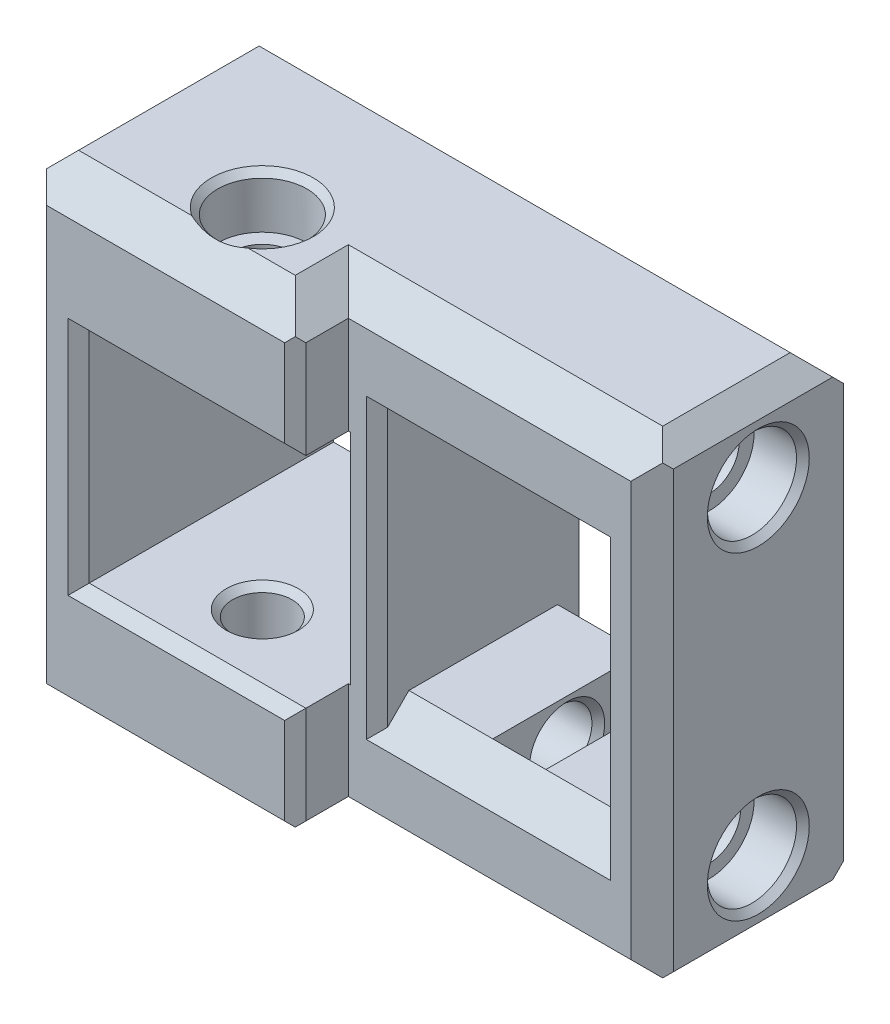
from build123d import *

# Parameters (mm, degrees)
SKETCH1_W               = 68.58
SKETCH1_H               = 57.15
BOSS_EXTRUDE1_DEPTH     = 31.75
SKETCH2_W               = 26.162
SKETCH2_H               = 26.162
SKETCH2_W_2             = 26.67
SKETCH2_H_2             = 27.94
CUT_EXTRUDE1_DEPTH      = 95.749149864
SKETCH5_R               = 3.556
SKETCH5_R_2             = 3.729278609
CUT_EXTRUDE2_DEPTH      = 95.749149864
CUT_EXTRUDE3_START      = -16.51
CUT_EXTRUDE3_DEPTH      = 6.35
SKETCH7_R               = 5.334
CUT_EXTRUDE4_DEPTH      = 5.842
CUT_EXTRUDE5_DEPTH      = 7.62
SKETCH10_W              = 36.322
SKETCH10_H              = 6.35
CUT_EXTRUDE6_DEPTH      = 95.749149864
CUT_EXTRUDE7_DEPTH      = 87.293112332
CUT_EXTRUDE7_DEPTH_BACK = 87.293112332
SKETCH12_R              = 3.556
SKETCH13_R              = 5.334
CUT_EXTRUDE8_DEPTH      = 6.35
CUT_EXTRUDE9_DEPTH      = 7.62
CHAMFER1_SIZE           = 0.762
CHAMFER3_SIZE           = 3.81
CHAMFER5_SIZE           = 1.27
CHAMFER6_SIZE           = 2.54
CHAMFER9_SIZE           = 3.81
CHAMFER10_SIZE          = 6.35


# Some blends are built 0.0001 mm under size
with BuildPart() as part:
    # Sketch1 → Boss-Extrude1 (new body)
    with BuildSketch(Plane.XY):
        with Locations((34.29, 28.575)):
            Rectangle(SKETCH1_W, SKETCH1_H)
    extrude(amount=BOSS_EXTRUDE1_DEPTH)

    # Sketch2 → Cut-Extrude1 (cut, through all)
    with BuildSketch(Plane.XY.offset(31.75)):
        with Locations((19.431, 28.575)):
            Rectangle(SKETCH2_W, SKETCH2_H)
        with Locations((49.022, 28.575)):
            Rectangle(SKETCH2_W_2, SKETCH2_H_2)
    extrude(amount=-CUT_EXTRUDE1_DEPTH, mode=Mode.SUBTRACT)

    # Sketch5 → Cut-Extrude2 (cut, through all)
    with BuildSketch(Plane(origin=(68.58, 0, 0), x_dir=(0, 0, -1), z_dir=(1, 0, 0))):
        with Locations((-12.7, 47.625)):
            Circle(SKETCH5_R)
        with Locations((-12.7, 9.525)):
            Circle(SKETCH5_R_2)
    extrude(amount=-CUT_EXTRUDE2_DEPTH, mode=Mode.SUBTRACT)

    # Sketch6 → Cut-Extrude3 (cut)
    with BuildSketch(Plane(origin=(68.58, 0, 0), x_dir=(0, 0, -1), z_dir=(1, 0, 0)).offset(CUT_EXTRUDE3_START)):
        with BuildLine():
            Line((-21.59, 47.625), (-21.59, 12.21272508))
            ThreePointArc((-21.59, 12.21272508), (-15.38772508, 0.635), (-3.81, 6.83727492))
            Line((-3.81, 6.83727492), (-3.81, 47.625))
            ThreePointArc((-3.81, 47.625), (-12.7, 56.515), (-21.59, 47.625))
        make_face()
    extrude(amount=-CUT_EXTRUDE3_DEPTH, mode=Mode.SUBTRACT)

    # Sketch7 → Cut-Extrude4 (cut)
    with BuildSketch(Plane(origin=(68.58, 0, 0), x_dir=(0, 0, -1), z_dir=(1, 0, 0))):
        with Locations((-12.7, 47.625)):
            Circle(SKETCH7_R)
        with Locations((-12.7, 9.525)):
            Circle(SKETCH7_R)
    extrude(amount=-CUT_EXTRUDE4_DEPTH, mode=Mode.SUBTRACT)

    # Sketch9 → Cut-Extrude5 (cut)
    with BuildSketch(Plane.ZY):
        Polygon((16.072880273, 53.467), (9.327119727, 53.467), (5.954239455, 47.625), (9.327119727, 41.783), (16.072880273, 41.783), (19.445760545, 47.625), align=None)
        Polygon((16.072880273, 15.367), (9.327119727, 15.367), (5.954239455, 9.525), (9.327119727, 3.683), (16.072880273, 3.683), (19.445760545, 9.525), align=None)
    extrude(amount=-CUT_EXTRUDE5_DEPTH, mode=Mode.SUBTRACT)

    # Sketch10 → Cut-Extrude6 (cut, through all)
    with BuildSketch(Plane(origin=(0, 57.15, 0), x_dir=(1, 0, 0), z_dir=(0, 1, 0))):
        with Locations((50.419, -28.575)):
            Rectangle(SKETCH10_W, SKETCH10_H)
    extrude(amount=-CUT_EXTRUDE6_DEPTH, mode=Mode.SUBTRACT)

    # Sketch12 → Cut-Extrude7 (cut, two sides: drawn at the far end of the back side and taken through both)
    with BuildSketch(Plane(origin=(0, 15.494, 0), x_dir=(1, 0, 0), z_dir=(0, 1, 0)).offset(-CUT_EXTRUDE7_DEPTH_BACK)):
        with Locations(Location((19.431, -22.86, 0), (0, 0, 180))):
            Circle(SKETCH12_R)
    extrude(amount=CUT_EXTRUDE7_DEPTH + CUT_EXTRUDE7_DEPTH_BACK, mode=Mode.SUBTRACT)

    # Sketch13 → Cut-Extrude8 (cut)
    with BuildSketch(Plane(origin=(0, 57.15, 0), x_dir=(1, 0, 0), z_dir=(0, 1, 0))):
        with Locations(Location((19.431, -22.86, 0), (0, 0, 270))):
            Circle(SKETCH13_R)
    extrude(amount=-CUT_EXTRUDE8_DEPTH, mode=Mode.SUBTRACT)

    # Sketch14 → Cut-Extrude9 (cut)
    with BuildSketch(Plane.XZ):
        Polygon((22.803880273, 28.702), (16.058119727, 28.702), (12.685239455, 22.86), (16.058119727, 17.018), (22.803880273, 17.018), (26.176760545, 22.86), align=None)
    extrude(amount=-CUT_EXTRUDE9_DEPTH, mode=Mode.SUBTRACT)

    # Chamfer1
    chamfer1_edges = [part.edges().sort_by_distance(p)[0] for p in [
        (0, 50.546, 17.759320409),
        (0, 53.467, 12.7),
        (0, 50.546, 7.640679591),
        (0, 44.704, 7.640679591),
        (0, 41.783, 12.7),
        (0, 44.704, 17.759320409),
        (0, 12.446, 17.759320409),
        (0, 15.367, 12.7),
        (0, 12.446, 7.640679591),
        (0, 6.604, 7.640679591),
        (0, 3.683, 12.7),
        (0, 6.604, 17.759320409),
        (22.987, 41.656, 22.86),
        (22.987, 15.494, 22.86),
        (19.431, 57.15, 17.526),
        (24.490320409, 0, 25.781),
        (19.431, 0, 28.702),
        (14.371679591, 0, 25.781),
        (14.371679591, 0, 19.939),
        (19.431, 0, 17.018),
        (24.490320409, 0, 19.939),
        (45.72, 47.625, 16.256),
        (45.72, 9.525, 16.429278609),
        (52.07, 9.525, 16.429278609),
        (52.07, 47.625, 16.256),
        (68.58, 47.625, 18.034),
        (68.58, 9.525, 18.034),
    ]]
    chamfer(chamfer1_edges, length=CHAMFER1_SIZE)

    # Chamfer3
    chamfer3_edges = [part.edges().sort_by_distance(p)[0] for p in [
        (49.022, 42.545, 25.4),
        (49.022, 14.605, 25.4),
        (49.022, 42.545, 0),
        (49.022, 14.605, 0),
    ]]
    chamfer(chamfer3_edges, length=CHAMFER3_SIZE - 0.0001)  # a hair under: the kernel refuses the full size

    # Chamfer5
    chamfer5_edges = [part.edges().sort_by_distance(p)[0] for p in [
        (19.304, 41.656, 31.75),
        (32.258, 49.403, 31.75),
        (32.258, 7.747, 31.75),
        (35.687, 28.575, 25.4),
        (62.357, 28.575, 25.4),
        (6.35, 28.575, 0),
        (19.431, 41.656, 0),
        (32.512, 28.575, 0),
        (19.431, 15.494, 0),
        (6.35, 28.575, 31.75),
        (19.304, 15.494, 31.75),
        (35.687, 28.575, 0),
        (62.357, 28.575, 0),
    ]]
    chamfer(chamfer5_edges, length=CHAMFER5_SIZE)

    # Chamfer6
    chamfer6_edges = [part.edges().sort_by_distance(p)[0] for p in [
        (68.58, 57.15, 12.7),
        (68.58, 0, 12.7),
        (68.58, 28.575, 25.4),
        (0, 28.575, 31.75),
        (68.58, 28.575, 0),
        (0, 28.575, 0),
        (0, 57.15, 15.875),
        (0, 0, 15.875),
    ]]
    chamfer(chamfer6_edges, length=CHAMFER6_SIZE)

    # Chamfer9
    # the kernel refuses this chamfer: 3.81 mm, written as the material it takes off along each edge
    with BuildSketch(Plane(origin=(32.258, 57.15, 25.4), x_dir=(0, 0.027495876610586386, -0.9996219169112968), z_dir=(1, 0, 0))) as chamfer9_piece_1:
        Polygon((CHAMFER9_SIZE * 0.999621916911, -CHAMFER9_SIZE * 0.0274958766106), (-CHAMFER9_SIZE * 0.0274958766106, -CHAMFER9_SIZE * 0.999621916911), (0, 0), align=None)
    extrude(amount=43.580112184, mode=Mode.SUBTRACT)
    with BuildSketch(Plane(origin=(32.258, 57.15, 40.278112184), x_dir=(-0.9996219169112968, 0.027495876610586414, 0), z_dir=(0, 0, -1))) as chamfer9_piece_2:
        Polygon((CHAMFER9_SIZE * 0.999621916911, -CHAMFER9_SIZE * 0.0274958766106), (-CHAMFER9_SIZE * 0.0274958766106, -CHAMFER9_SIZE * 0.999621916911), (0, 0), align=None)
    extrude(amount=14.878112184, mode=Mode.SUBTRACT)
    with BuildSketch(Plane(origin=(40.786112184, 57.15, 31.75), x_dir=(0, 0.027495876610586386, -0.9996219169112968), z_dir=(-1, 0, 0)), Plane(origin=(-7.258112184, 0, 31.75), x_dir=(0, -0.027495876610586376, -0.9996219169112968), z_dir=(1, 0, 0))) as chamfer9_piece_3:
        Polygon((CHAMFER9_SIZE * 0.999621916911, CHAMFER9_SIZE * 0.0274958766106), (-CHAMFER9_SIZE * 0.0274958766106, CHAMFER9_SIZE * 0.999621916911), (0, 0), align=None)
    extrude(amount=48.044224368, mode=Mode.SUBTRACT)
    with BuildSketch(Plane(origin=(32.258, 0, 40.278112184), x_dir=(-0.9996219169112968, -0.02749587661058639, 0), z_dir=(0, 0, -1))) as chamfer9_piece_4:
        Polygon((CHAMFER9_SIZE * 0.999621916911, CHAMFER9_SIZE * 0.0274958766106), (-CHAMFER9_SIZE * 0.0274958766106, CHAMFER9_SIZE * 0.999621916911), (0, 0), align=None)
    extrude(amount=14.878112184, mode=Mode.SUBTRACT)
    with BuildSketch(Plane(origin=(32.258, 0, 25.4), x_dir=(0, -0.027495876610586403, -0.9996219169112968), z_dir=(1, 0, 0))) as chamfer9_piece_5:
        Polygon((CHAMFER9_SIZE * 0.999621916911, CHAMFER9_SIZE * 0.0274958766106), (-CHAMFER9_SIZE * 0.0274958766106, CHAMFER9_SIZE * 0.999621916911), (0, 0), align=None)
    extrude(amount=43.580112184, mode=Mode.SUBTRACT)
    with BuildSketch(Plane(origin=(32.258, 57.15, 40.278112184), x_dir=(-0.9996219169112968, 0.027495876610586414, 0), z_dir=(0, 0, -1))) as chamfer9_piece_6a_section:
        Polygon((CHAMFER9_SIZE * 0.999621916911, -CHAMFER9_SIZE * 0.0274958766106), (-CHAMFER9_SIZE * 0.0274958766106, -CHAMFER9_SIZE * 0.999621916911), (0, 0), align=None)
    chamfer9_piece_6a = extrude(amount=24.676224368, mode=Mode.PRIVATE)
    chamfer9_piece_6a = split(chamfer9_piece_6a, bisect_by=Plane(origin=(31.001486282, 55.893486282, 25.4), z_dir=(0, 0, -1)), keep=Keep.TOP, mode=Mode.PRIVATE)
    with BuildSketch(Plane(origin=(22.459887816, 57.15, 25.4), x_dir=(0, 0.027495876610586386, -0.9996219169112968), z_dir=(1, 0, 0))) as chamfer9_piece_6b_section:
        Polygon((CHAMFER9_SIZE * 0.999621916911, -CHAMFER9_SIZE * 0.0274958766106), (-CHAMFER9_SIZE * 0.0274958766106, -CHAMFER9_SIZE * 0.999621916911), (0, 0), align=None)
    chamfer9_piece_6b = extrude(amount=53.378224368, mode=Mode.PRIVATE)
    chamfer9_piece_6b = split(chamfer9_piece_6b, bisect_by=Plane(origin=(32.258, 55.893486282, 24.143486282), z_dir=(-1, 0, 0)), keep=Keep.TOP, mode=Mode.PRIVATE)
    chamfer9_piece_6 = chamfer9_piece_6a & chamfer9_piece_6b
    add(chamfer9_piece_6, mode=Mode.SUBTRACT)
    with BuildSketch(Plane(origin=(32.258, 0, 40.278112184), x_dir=(-0.9996219169112968, -0.02749587661058639, 0), z_dir=(0, 0, -1))) as chamfer9_piece_7a_section:
        Polygon((CHAMFER9_SIZE * 0.999621916911, CHAMFER9_SIZE * 0.0274958766106), (-CHAMFER9_SIZE * 0.0274958766106, CHAMFER9_SIZE * 0.999621916911), (0, 0), align=None)
    chamfer9_piece_7a = extrude(amount=24.676224368, mode=Mode.PRIVATE)
    chamfer9_piece_7a = split(chamfer9_piece_7a, bisect_by=Plane(origin=(31.001486282, 1.256513718, 25.4), z_dir=(0, 0, -1)), keep=Keep.TOP, mode=Mode.PRIVATE)
    with BuildSketch(Plane(origin=(22.459887816, 0, 25.4), x_dir=(0, -0.02749587661058639, -0.9996219169112968), z_dir=(1, 0, 0))) as chamfer9_piece_7b_section:
        Polygon((CHAMFER9_SIZE * 0.999621916911, CHAMFER9_SIZE * 0.0274958766106), (-CHAMFER9_SIZE * 0.0274958766106, CHAMFER9_SIZE * 0.999621916911), (0, 0), align=None)
    chamfer9_piece_7b = extrude(amount=53.378224368, mode=Mode.PRIVATE)
    chamfer9_piece_7b = split(chamfer9_piece_7b, bisect_by=Plane(origin=(32.258, 1.256513718, 24.143486282), z_dir=(-1, 0, 0)), keep=Keep.TOP, mode=Mode.PRIVATE)
    chamfer9_piece_7 = chamfer9_piece_7a & chamfer9_piece_7b
    add(chamfer9_piece_7, mode=Mode.SUBTRACT)

    # Chamfer10
    # the kernel refuses this chamfer: 6.35 mm, written as the material it takes off along each edge
    with BuildSketch(Plane(origin=(82.370186974, 57.15, 0), x_dir=(0, -0.9996219169112968, -0.027495876610586355), z_dir=(-1, 0, 0)), Plane(origin=(-13.790186974, 0, 0), x_dir=(0, 0.9996219169112966, -0.02749587661058638), z_dir=(1, 0, 0))) as chamfer10_piece_1:
        Polygon((CHAMFER10_SIZE * 0.999621916911, CHAMFER10_SIZE * 0.0274958766106), (-CHAMFER10_SIZE * 0.0274958766106, CHAMFER10_SIZE * 0.999621916911), (0, 0), align=None)
    extrude(amount=96.160373947, mode=Mode.SUBTRACT)


solid = part.part
